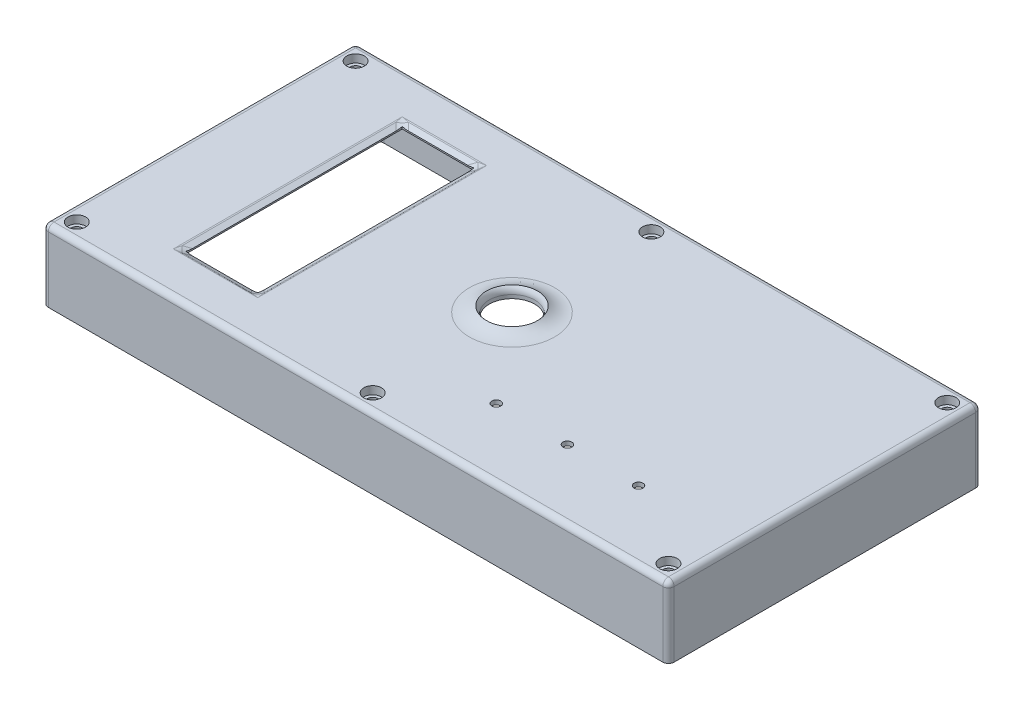
from build123d import *

# Parameters (mm, degrees)
SKETCH1_W                                = 220
SKETCH1_H                                = 110
BOSS_EXTRUDE1_DEPTH                      = 25
CBORE_FOR_M4_PAN_HEAD_SCREW1_D           = 4
CBORE_FOR_M4_PAN_HEAD_SCREW1_CBORE_D     = 6.2
CBORE_FOR_M4_PAN_HEAD_SCREW1_CBORE_DEPTH = 2.8
SHELL17_DEPTH                            = 23.5
SHELL17_2_DEPTH                          = 17.2
SKETCH2_W                                = 218.00000000000003
SKETCH2_H                                = 108
CUT_EXTRUDE2_DEPTH                       = 4
FILLET1_R                                = 2
SKETCH9_W                                = 25.200000000000017
SKETCH9_H                                = 76
CUT_EXTRUDE4_DEPTH                       = 126.49900398011137
FILLET5_SIZE                             = 2
FILLET5_SIZE2                            = 1
FILLET6_R                                = 1
FILLET8_R                                = 5
SKETCH20_R                               = 9
BOSS_EXTRUDE4_DEPTH                      = 2
CUT_EXTRUDE7_DEPTH                       = 126.49900398011137
CUT_EXTRUDE7_DEPTH_BACK                  = 126.49900398011137
SKETCH12_R                               = 8
FILLET10_R                               = 10
FILLET14_R                               = 3
SKETCH13_R                               = 1.549999999999994
SKETCH13_R_2                             = 1.5500000000000007
CUT_EXTRUDE8_DEPTH                       = 10
SKETCH21_R                               = 2.9
BOSS_EXTRUDE6_DEPTH                      = 6
M3_TAPPED_HOLE1_D                        = 2.5
M3_TAPPED_HOLE1_DEPTH                    = 5
M3_TAPPED_HOLE1_TIP                      = 0.7510757737844503
SKETCH27_R                               = 3.0000000000000084
SKETCH27_R_2                             = 3.0000000000000018
BOSS_EXTRUDE9_DEPTH                      = 6
M3_5X0_6_TAPPED_HOLE1_D                  = 2.9
M3_5X0_6_TAPPED_HOLE1_DEPTH              = 6
M3_5X0_6_TAPPED_HOLE1_TIP                = 0.8712478975899624
FILLET19_R                               = 0.5
CUT_EXTRUDE9_DEPTH                       = 6.3
FILLET17_R                               = 0.25
FILLET20_R                               = 0.5
FILLET21_R                               = 0.25
FILLET22_R                               = 2


# Read off the part's stored shape, not the designer's step: Shell17
# Some blends are built 0.0001 mm under size
with BuildPart() as part:
    # Sketch1 → Boss-Extrude1 (new body)
    with BuildSketch(Plane(origin=(0, 0, 0), x_dir=(1, 0, 0), z_dir=(0, 1, 0))):
        Rectangle(SKETCH1_W, SKETCH1_H)
    extrude(amount=BOSS_EXTRUDE1_DEPTH)

    # CBORE for M4 Pan Head Screw1 (through all)
    with Locations(Plane(origin=(0, 25, 0), x_dir=(1, 0, 0), z_dir=(0, 1, 0))):
        with Locations((-104, 49), (0, 49), (104, 49), (104, -49), (0, -49), (-104, -49)):
            CounterBoreHole(CBORE_FOR_M4_PAN_HEAD_SCREW1_D / 2, CBORE_FOR_M4_PAN_HEAD_SCREW1_CBORE_D / 2, CBORE_FOR_M4_PAN_HEAD_SCREW1_CBORE_DEPTH)

    # Shell17 outline → Shell17 (cut)
    with BuildSketch(Plane(origin=(0, 0, 0), x_dir=(1, 0, 0), z_dir=(0, 1, 0))):
        with BuildLine():
            Line((-8.038034586, 50), (-95.961965414, 50))
            ThreePointArc((-95.961965414, 50), (-98.272435072, 43.272435072), (-105, 40.961965414))
            Line((-105, 40.961965414), (-105, -40.961965414))
            ThreePointArc((-105, -40.961965414), (-98.272435072, -43.272435072), (-95.961965414, -50))
            Line((-95.961965414, -50), (-8.038034586, -50))
            ThreePointArc((-8.038034586, -50), (0, -40.9), (8.038034586, -50))
            Line((8.038034586, -50), (95.961965414, -50))
            ThreePointArc((95.961965414, -50), (98.272435072, -43.272435072), (105, -40.961965414))
            Line((105, -40.961965414), (105, 40.961965414))
            ThreePointArc((105, 40.961965414), (98.272435072, 43.272435072), (95.961965414, 50))
            Line((95.961965414, 50), (8.038034586, 50))
            ThreePointArc((8.038034586, 50), (0, 40.9), (-8.038034586, 50))
        make_face()
    extrude(amount=SHELL17_DEPTH, mode=Mode.SUBTRACT)

    # Shell17 2 outline → Shell17 2 (cut)
    with BuildSketch(Plane(origin=(0, 0, 0), x_dir=(1, 0, 0), z_dir=(0, 1, 0))):
        with BuildLine():
            Line((-95.961965414, 50), (-97.07179677, 50))
            ThreePointArc((-97.07179677, 50), (-99.050252532, 44.050252532), (-105, 42.07179677))
            Line((-105, 42.07179677), (-105, 40.961965414))
            ThreePointArc((-105, 40.961965414), (-98.272435072, 43.272435072), (-95.961965414, 50))
        make_face()
        with BuildLine():
            Line((-6.92820323, 50), (-8.038034586, 50))
            ThreePointArc((-8.038034586, 50), (0, 40.9), (8.038034586, 50))
            Line((8.038034586, 50), (6.92820323, 50))
            ThreePointArc((6.92820323, 50), (0, 42), (-6.92820323, 50))
        make_face()
        with BuildLine():
            ThreePointArc((-95.961965414, -50), (-98.272435072, -43.272435072), (-105, -40.961965414))
            Line((-105, -40.961965414), (-105, -42.07179677))
            ThreePointArc((-105, -42.07179677), (-99.050252532, -44.050252532), (-97.07179677, -50))
            Line((-97.07179677, -50), (-95.961965414, -50))
        make_face()
        with BuildLine():
            Line((97.07179677, 50), (95.961965414, 50))
            ThreePointArc((95.961965414, 50), (98.272435072, 43.272435072), (105, 40.961965414))
            Line((105, 40.961965414), (105, 42.07179677))
            ThreePointArc((105, 42.07179677), (99.050252532, 44.050252532), (97.07179677, 50))
        make_face()
        with BuildLine():
            ThreePointArc((8.038034586, -50), (0, -40.9), (-8.038034586, -50))
            Line((-8.038034586, -50), (-6.92820323, -50))
            ThreePointArc((-6.92820323, -50), (0, -42), (6.92820323, -50))
            Line((6.92820323, -50), (8.038034586, -50))
        make_face()
        with BuildLine():
            Line((105, -42.07179677), (105, -40.961965414))
            ThreePointArc((105, -40.961965414), (98.272435072, -43.272435072), (95.961965414, -50))
            Line((95.961965414, -50), (97.07179677, -50))
            ThreePointArc((97.07179677, -50), (99.050252532, -44.050252532), (105, -42.07179677))
        make_face()
    extrude(amount=SHELL17_2_DEPTH, mode=Mode.SUBTRACT)

    # Sketch2 → Cut-Extrude2 (cut)
    with BuildSketch(Plane.XZ):
        Rectangle(SKETCH2_W, SKETCH2_H)
    extrude(amount=-CUT_EXTRUDE2_DEPTH, mode=Mode.SUBTRACT)

    # Fillet1
    fillet1_edges = [part.edges().sort_by_distance(p)[0] for p in [
        (-110.00000000000003, 25, 1.421e-14),
        (-2.842e-14, 25, 55.000000000000014),
        (109.99999999999997, 25, 1.421e-14),
        (109.99999999999997, 12.5, 55.000000000000014),
        (-110.00000000000003, 12.5, 55.000000000000014),
        (-110.00000000000003, 12.5, -54.999999999999986),
        (109.99999999999997, 12.5, -54.999999999999986),
        (-2.842e-14, 25, -54.999999999999986),
    ]]
    fillet(fillet1_edges, radius=FILLET1_R)

    # Sketch9 → Cut-Extrude4 (cut, through all)
    with BuildSketch(Plane(origin=(0, 25, 0), x_dir=(1, 0, 0), z_dir=(0, 1, 0))):
        with Locations((-63.99565155268026, 0)):
            Rectangle(SKETCH9_W, SKETCH9_H)
    extrude(amount=-CUT_EXTRUDE4_DEPTH, mode=Mode.SUBTRACT)

    # Fillet5
    fillet5_edges = [part.edges().sort_by_distance(p)[0] for p in [
        (-76.59565155268027, 25, 0),
        (-63.99565155268026, 25, 38),
        (-51.39565155268025, 25, 0),
        (-63.99565155268026, 25, -38),
    ]]
    fillet5_side = [part.faces().sort_by_distance(p)[0] for p in [
        (5.892620205986709, 25, 1.757e-14),
    ]]
    chamfer(fillet5_edges, length=FILLET5_SIZE, length2=FILLET5_SIZE2, reference=fillet5_side[0])

    # Fillet6
    fillet6_edges = [part.edges().sort_by_distance(p)[0] for p in [
        (-63.99565155268026, 25, -40),
        (-49.39565155268025, 25, 7.11e-15),
        (-63.99565155268026, 25, 40),
        (-78.59565155268027, 25, -7.11e-15),
    ]]
    fillet(fillet6_edges, radius=FILLET6_R)

    # Fillet8
    fillet8_edges = [part.edges().sort_by_distance(p)[0] for p in [
        (-50.501224361680336, 24.447213595499953, -38.894427190999906),
        (-77.49007874368019, 24.44721359549996, -38.894427190999906),
        (-50.50122436168033, 24.447213595499953, 38.89442719099989),
        (-77.49007874368017, 24.447213595499957, 38.89442719099991),
        (-78.60493553798742, 24.97394508104162, -40.00928398530714),
        (-78.604935537987, 24.973945081041524, 40.00928398530672),
        (-49.38636756737369, 24.97394508104148, -40.00928398530654),
        (-49.38636756737358, 24.973945081041506, 40.009283985306645),
    ]]
    fillet(fillet8_edges, radius=FILLET8_R)

    # Sketch20 → Boss-Extrude4 (add)
    with BuildSketch(Plane(origin=(0, 25, 0), x_dir=(1, 0, 0), z_dir=(0, 1, 0))):
        with Locations(Location((0, 0, 0), (0, 0, 90))):
            Circle(SKETCH20_R)
    extrude(amount=BOSS_EXTRUDE4_DEPTH)

    # Sketch12 → Cut-Extrude7 (cut, two sides: drawn at the far end of the back side and taken through both)
    with BuildSketch(Plane(origin=(0, 25, 0), x_dir=(1, 0, 0), z_dir=(0, 1, 0)).offset(-CUT_EXTRUDE7_DEPTH_BACK)):
        with Locations(Location((0, 0, 0), (0, 0, 270))):
            Circle(SKETCH12_R)
    extrude(amount=CUT_EXTRUDE7_DEPTH + CUT_EXTRUDE7_DEPTH_BACK, mode=Mode.SUBTRACT)

    # Fillet10
    # the kernel refuses this fillet: 10 mm, written as the material it adds along each edge
    with BuildSketch(Plane(origin=(0, 25, 0), x_dir=(6e-17, 0, -1), z_dir=(1, 0, 6e-17))) as fillet10_piece_1:
        with BuildLine():
            CenterArc((15.000000000000632, 10), FILLET10_R, 233.13010235415305, 36.86989764584695)
            Line((9.000000000000227, 2.0000000000003055), (8.88000000000022, 1.8400000000003125))
            ThreePointArc((8.88000000000022, 1.8400000000003125), (8.8, 1.0000000000001528), (8.8, 0))
            Line((8.8, 0), (9, -0.1999999999999993))
            Line((9, -0.1999999999999993), (15.000000000000632, -0.1999999999999993))
            Line((15.000000000000632, -0.1999999999999993), (15.000000000000632, 0))
        make_face()
    revolve(axis=Axis((0, 25, 0), (0, 1, 0)))

    # Fillet14
    # the kernel refuses this fillet: 3 mm, written as the material it takes off along each edge
    with BuildSketch(Plane(origin=(0, 27, 0), x_dir=(-1.8e-16, 0, 1), z_dir=(1, 0, 1.8e-16))) as fillet14_piece_1:
        with BuildLine():
            CenterArc((11, 2.23606797749979), FILLET14_R, 180, 48.18968510422138)
            Line((8, 2.23606797749979), (7.94, 2.23606797749979))
            Line((7.94, 2.23606797749979), (7.94, 0))
            Line((7.94, 0), (8, -0.05999999999999872))
            ThreePointArc((8, -0.05999999999999872), (8.5, -0.05999999999999872), (8.96, -0.04472135954999601))
            Line((8.96, -0.04472135954999601), (9, 0))
        make_face()
    revolve(axis=Axis((0, 27, 0), (0, -1, 0)), mode=Mode.SUBTRACT)

    # Sketch13 → Cut-Extrude8 (cut)
    with BuildSketch(Plane(origin=(0, 25, 0), x_dir=(1, 0, 0), z_dir=(0, 1, 0))):
        with Locations(Location((25, -30.52, 0), (0, 0, 270))):
            Circle(SKETCH13_R)
        with Locations(Location((50, -30.52, 0), (0, 0, 270))):
            Circle(SKETCH13_R_2)
        with Locations(Location((75.00000000000001, -30.52, 0), (0, 0, 270))):
            Circle(SKETCH13_R)
    extrude(amount=-CUT_EXTRUDE8_DEPTH, mode=Mode.SUBTRACT)

    # Sketch21 → Boss-Extrude6 (add)
    with BuildSketch(Plane.XZ.offset(-23.5)):
        with Locations(Location((23, 35.78999999999999, 0), (0, 0, 270))):
            Circle(SKETCH21_R)
        with Locations(Location((86, 35.78999999999999, 0), (0, 0, 270))):
            Circle(SKETCH21_R)
        with Locations(Location((86, 3, 0), (0, 0, 270))):
            Circle(SKETCH21_R)
        with Locations(Location((23, 3, 0), (0, 0, 270))):
            Circle(SKETCH21_R)
    extrude(amount=BOSS_EXTRUDE6_DEPTH)

    # M3 Tapped Hole1
    with Locations(Plane(origin=(23, 17.5, 35.79), x_dir=(0, 0, -1), z_dir=(0, -1, 0))):
        with Locations((0, 0), (32.79, 0), (32.79, 63), (0, 63)):
            Hole(M3_TAPPED_HOLE1_D / 2, depth=M3_TAPPED_HOLE1_DEPTH)
            with Locations((0, 0, -(M3_TAPPED_HOLE1_DEPTH + M3_TAPPED_HOLE1_TIP / 2))):  # 118° drill point
                Cone(0, M3_TAPPED_HOLE1_D / 2, M3_TAPPED_HOLE1_TIP, mode=Mode.SUBTRACT)

    # Sketch27 → Boss-Extrude9 (add)
    with BuildSketch(Plane(origin=(0, 23.5, 0), x_dir=(-1, 0, 0), z_dir=(0, -1, 0))):
        with Locations(Location((91.49565155268023, 46.50434844731978, 0), (0, 0, 90))):
            Circle(SKETCH27_R)
        with Locations(Location((36.49565155268025, 46.5, 0), (0, 0, 90))):
            Circle(SKETCH27_R_2)
        with Locations(Location((36.49565155268025, -46.5, 0), (0, 0, 90))):
            Circle(SKETCH27_R_2)
        with Locations(Location((91.49565155268023, -46.5, 0), (0, 0, 90))):
            Circle(SKETCH27_R)
    extrude(amount=BOSS_EXTRUDE9_DEPTH)

    # M3.5x0.6 Tapped Hole1
    with Locations(Plane(origin=(-91.495651553, 17.5, -46.504348447), x_dir=(0, 0, -1), z_dir=(0, -1, 0))):
        with Locations((0, 0), (-0.004348447, 55), (-93.004348447, 55), (-93.004348447, 0)):
            Hole(M3_5X0_6_TAPPED_HOLE1_D / 2, depth=M3_5X0_6_TAPPED_HOLE1_DEPTH)
            with Locations((0, 0, -(M3_5X0_6_TAPPED_HOLE1_DEPTH + M3_5X0_6_TAPPED_HOLE1_TIP / 2))):  # 118° drill point
                Cone(0, M3_5X0_6_TAPPED_HOLE1_D / 2, M3_5X0_6_TAPPED_HOLE1_TIP, mode=Mode.SUBTRACT)

    # Fillet19
    fillet19_edges = [part.edges().sort_by_distance(p)[0] for p in [
        (-91.49565155268023, 23.5, -43.50434844731977),
        (-36.49565155268025, 23.5, -43.5),
        (-36.49565155268025, 23.5, 49.5),
        (-91.49565155268023, 23.5, 49.50000000000001),
    ]]
    fillet(fillet19_edges, radius=FILLET19_R - 0.0001)  # a hair under: the kernel refuses the full size

    # Sketch33 → Cut-Extrude9 (cut)
    with BuildSketch(Plane.XZ.offset(-17.2)):
        with BuildLine():
            Line((6.928203230275507, -49.999999999999986), (8.038034585643432, -49.999999999999986))
            ThreePointArc((8.038034585643432, -49.999999999999986), (2.29e-15, -40.899999999999984), (-8.038034585643432, -49.999999999999986))
            Line((-8.038034585643432, -49.999999999999986), (-6.928203230275509, -49.999999999999986))
            ThreePointArc((-6.928203230275509, -49.999999999999986), (4.3e-16, -41.999999999999986), (6.928203230275507, -49.999999999999986))
        make_face()
        with BuildLine():
            Line((104.99999999999997, -40.961965414356555), (104.99999999999997, -42.071796769724486))
            ThreePointArc((104.99999999999997, -42.071796769724486), (99.05025253169414, -44.050252531694156), (97.07179676972449, -49.999999999999986))
            Line((97.07179676972449, -49.999999999999986), (95.96196541435653, -49.99999999999998))
            ThreePointArc((95.96196541435653, -49.99999999999998), (98.27243507238894, -43.272435072388944), (104.99999999999997, -40.961965414356555))
        make_face()
        with BuildLine():
            Line((-105.00000000000003, -40.961965414356555), (-105.00000000000003, -42.071796769724486))
            ThreePointArc((-105.00000000000003, -42.071796769724486), (-99.0502525316942, -44.05025253169416), (-97.07179676972453, -49.999999999999986))
            Line((-97.07179676972453, -49.999999999999986), (-95.96196541435658, -49.999999999999986))
            ThreePointArc((-95.96196541435658, -49.999999999999986), (-98.27243507238899, -43.272435072388944), (-105.00000000000003, -40.961965414356555))
        make_face()
        with BuildLine():
            Line((-97.07179676972453, 50.000000000000014), (-95.96196541435658, 50.000000000000014))
            ThreePointArc((-95.96196541435658, 50.000000000000014), (-98.27243507238899, 43.27243507238897), (-105.00000000000003, 40.96196541435658))
            Line((-105.00000000000003, 40.96196541435658), (-105.00000000000003, 42.071796769724514))
            ThreePointArc((-105.00000000000003, 42.071796769724514), (-99.0502525316942, 44.05025253169419), (-97.07179676972453, 50.000000000000014))
        make_face()
        with BuildLine():
            Line((8.038034585643432, 50.000000000000014), (6.928203230275505, 50.000000000000014))
            ThreePointArc((6.928203230275505, 50.000000000000014), (-1.29e-15, 42.000000000000014), (-6.928203230275505, 50.000000000000014))
            Line((-6.928203230275505, 50.000000000000014), (-8.038034585643432, 50.000000000000014))
            ThreePointArc((-8.038034585643432, 50.000000000000014), (-1.49e-15, 40.90000000000001), (8.038034585643432, 50.000000000000014))
        make_face()
        with BuildLine():
            Line((95.96196541435653, 50.000000000000014), (97.07179676972446, 50.000000000000014))
            ThreePointArc((97.07179676972446, 50.000000000000014), (99.05025253169413, 44.05025253169418), (104.99999999999997, 42.07179676972451))
            Line((104.99999999999997, 42.07179676972451), (104.99999999999997, 40.96196541435658))
            ThreePointArc((104.99999999999997, 40.96196541435658), (98.27243507238893, 43.27243507238897), (95.96196541435653, 50.000000000000014))
        make_face()
    extrude(amount=-CUT_EXTRUDE9_DEPTH, mode=Mode.SUBTRACT)

    # Fillet17
    fillet17_edges = [part.edges().sort_by_distance(p)[0] for p in [
        (-91.49565155268023, 17.5, -43.50434844731977),
        (-36.49565155268025, 17.5, -43.5),
        (-36.49565155268025, 17.5, 49.5),
        (-91.49565155268023, 17.5, 49.50000000000001),
    ]]
    fillet(fillet17_edges, radius=FILLET17_R)

    # Fillet20
    fillet20_edges = [part.edges().sort_by_distance(p)[0] for p in [
        (23, 23.5, 38.68999999999999),
        (86, 23.5, 38.68999999999999),
        (86, 23.5, 5.9),
        (23, 23.5, 5.9),
    ]]
    fillet(fillet20_edges, radius=FILLET20_R)

    # Fillet21
    fillet21_edges = [part.edges().sort_by_distance(p)[0] for p in [
        (23, 17.5, 38.68999999999999),
        (86, 17.5, 38.68999999999999),
        (86, 17.5, 5.9),
        (23, 17.5, 5.9),
    ]]
    fillet(fillet21_edges, radius=FILLET21_R)

    # Fillet22
    fillet22_edges = [part.edges().sort_by_distance(p)[0] for p in [
        (-97.07179677, 10.6, -50),
        (-105, 10.6, -42.07179677),
        (6.92820323, 10.6, -50),
        (-6.928203230000001, 10.6, -50),
        (105, 10.6, -42.07179677),
        (97.07179677, 10.6, -50),
        (97.07179677, 10.6, 50),
        (105, 10.6, 42.07179677),
        (-6.92820323, 10.6, 50),
        (6.928203230000001, 10.6, 50),
        (-105, 10.6, 42.07179677),
        (-97.07179677, 10.6, 50),
        (109, 2, 53.99999999999999),
        (109, 2, -54.00000000000001),
        (-109, 2, -54.00000000000001),
        (-109, 2, 53.99999999999999),
    ]]
    fillet(fillet22_edges, radius=FILLET22_R)


solid = part.part
